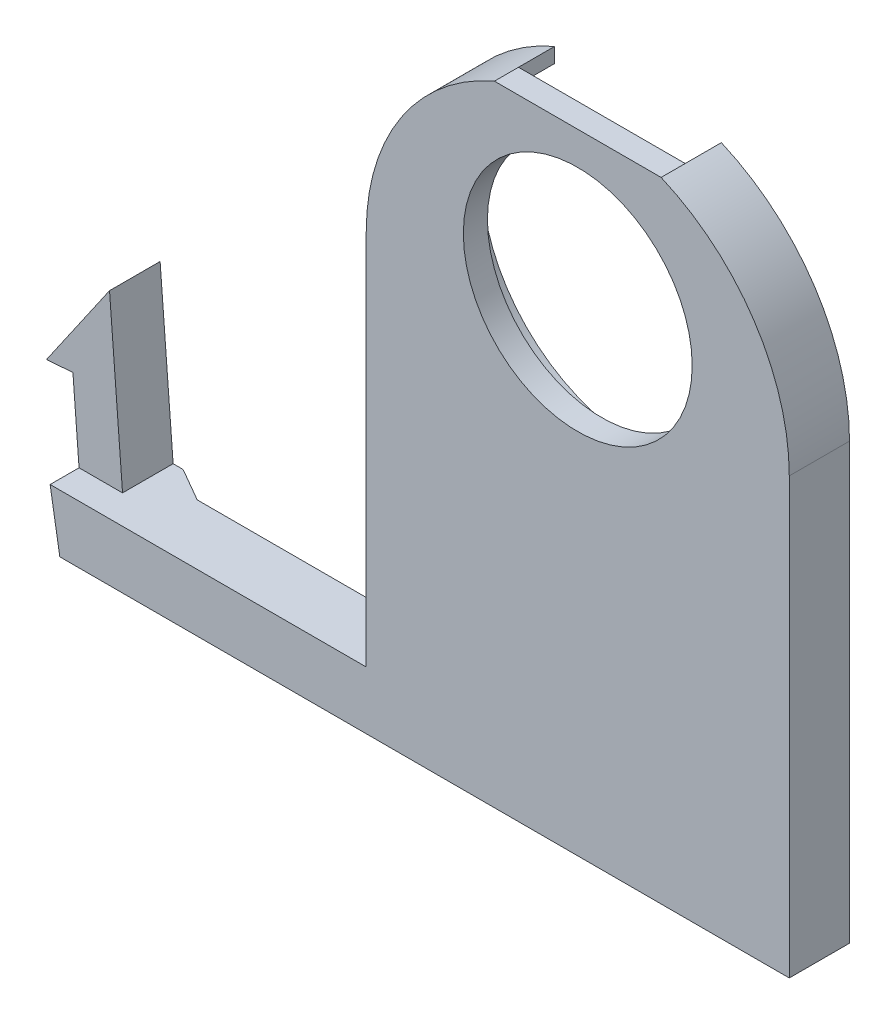
from build123d import *

# Parameters (mm, degrees)
BOSS_EXTRUDE1_DEPTH      = 1.5
BOSS_EXTRUDE2_DEPTH      = 1
SKETCH4_R                = 4.75
CUT_EXTRUDE1_DEPTH       = 23.898325822
SKETCH5_W                = 17.56
SKETCH5_H                = 2.5
BOSS_EXTRUDE3_DEPTH      = 0.15
SKETCH6_W                = 17.56
SKETCH6_H                = 2.5
BOSS_EXTRUDE4_DEPTH      = 11.35
SKETCH7_W                = 2.5
SKETCH7_H                = 2.4
BOSS_EXTRUDE5_DEPTH      = 12.72
BOSS_EXTRUDE6_DEPTH      = 0.8
BOSS_EXTRUDE6_DEPTH_BACK = 1.3
SKETCH9_W                = 1.40416608
SKETCH9_H                = 2.4
BOSS_EXTRUDE7_DEPTH      = 0.8
CHAMFER3_SIZE            = 1.039230485
CHAMFER3_SIZE_2          = 1.8
BOSS_EXTRUDE8_DEPTH      = 1.2


with BuildPart() as part:
    # Sketch1 → Boss-Extrude1 (new body)
    with BuildSketch(Plane.XY):
        with BuildLine():
            ThreePointArc((14.980604809, 6.55), (8.78, 2), (2.579395191, 6.55))
            Line((2.579395191, 6.55), (0, 6.55))
            Line((0, 6.55), (0, 0))
            Line((0, 0), (17.56, 0))
            Line((17.56, 0), (17.56, 6.55))
            Line((17.56, 6.55), (14.980604809, 6.55))
        make_face()
        with BuildLine():
            ThreePointArc((2.579395191, 6.55), (2.679421093, 10.743420825), (5.32, 14.002581212))
            Line((5.32, 14.002581212), (5.32, 14.619498126))
            ThreePointArc((5.32, 14.619498126), (1.449679407, 11.382680416), (0, 6.55))
            Line((0, 6.55), (2.579395191, 6.55))
        make_face()
        with BuildLine():
            ThreePointArc((12.24, 14.002581212), (14.880578907, 10.743420825), (14.980604809, 6.55))
            Line((14.980604809, 6.55), (17.56, 6.55))
            ThreePointArc((17.56, 6.55), (16.110320593, 11.382680416), (12.24, 14.619498126))
            Line((12.24, 14.619498126), (12.24, 14.002581212))
        make_face()
    extrude(amount=BOSS_EXTRUDE1_DEPTH)

    # Sketch3 → Boss-Extrude2 (add)
    with BuildSketch(Plane.XY.offset(1.5)):
        with BuildLine():
            Line((12.24, 14.619498126), (12.24, 14.002581212))
            ThreePointArc((12.24, 14.002581212), (8.78, 2), (5.32, 14.002581212))
            Line((5.32, 14.002581212), (5.32, 14.619498126))
            ThreePointArc((5.32, 14.619498126), (1.449679407, 11.382680416), (0, 6.55))
            Line((0, 6.55), (0, 0))
            Line((0, 0), (17.56, 0))
            Line((17.56, 0), (17.56, 6.55))
            ThreePointArc((17.56, 6.55), (16.110320593, 11.382680416), (12.24, 14.619498126))
        make_face()
        with BuildLine():
            Line((5.32, 14.619498126), (12.24, 14.619498126))
            Line((12.24, 14.619498126), (12.24, 14.002581212))
            ThreePointArc((12.24, 14.002581212), (8.78, 2), (5.32, 14.002581212))
            Line((5.32, 14.002581212), (5.32, 14.619498126))
        make_face()
    extrude(amount=BOSS_EXTRUDE2_DEPTH)

    # Sketch4 → Cut-Extrude1 (cut, through all)
    with BuildSketch(Plane(origin=(0, 0, 1.5), x_dir=(-1, 0, 0), z_dir=(0, 0, -1))):
        with Locations((-8.78, 8.5)):
            Circle(SKETCH4_R)
    extrude(amount=-CUT_EXTRUDE1_DEPTH, mode=Mode.SUBTRACT)

    # Sketch5 → Boss-Extrude3 (add)
    with BuildSketch(Plane.XZ):
        with Locations((8.78, 1.25)):
            Rectangle(SKETCH5_W, SKETCH5_H)
    extrude(amount=BOSS_EXTRUDE3_DEPTH)

    # Sketch6 → Boss-Extrude4 (add)
    with BuildSketch(Plane.XZ.offset(0.15)):
        with Locations((8.78, 1.25)):
            Rectangle(SKETCH6_W, SKETCH6_H)
    extrude(amount=BOSS_EXTRUDE4_DEPTH)

    # Sketch7 → Boss-Extrude5 (add)
    with BuildSketch(Plane.ZY):
        with Locations((1.25, -10.3)):
            Rectangle(SKETCH7_W, SKETCH7_H)
    extrude(amount=BOSS_EXTRUDE5_DEPTH)

    # Sketch8 → Boss-Extrude6 (add, two sides: drawn at the far end of the back side and taken through both)
    with BuildSketch(Plane(origin=(0, 0, 0), x_dir=(-1, 0, 0), z_dir=(0, 0, -1)).offset(-BOSS_EXTRUDE6_DEPTH_BACK)):
        Polygon((13.121190309, -9.1), (13.375962235, -5.8), (14.472698599, -5.884672011), (11.85625922, -2.1), (11.31583392, -9.1), (12.72, -9.1), (12.72, -11.5), align=None)
    extrude(amount=BOSS_EXTRUDE6_DEPTH + BOSS_EXTRUDE6_DEPTH_BACK)

    # Sketch9 → Boss-Extrude7 (add)
    with BuildSketch(Plane(origin=(0, 0, 0), x_dir=(-1, 0, 0), z_dir=(0, 0, -1))):
        with Locations((12.01791696, -10.3)):
            Rectangle(SKETCH9_W, SKETCH9_H)
    extrude(amount=BOSS_EXTRUDE7_DEPTH)

    # Chamfer3
    # the kernel refuses this chamfer: 1.8, 1.039230485 mm, written as the material it adds along each edge
    with BuildSketch(Plane(origin=(-11.31583392, -11.5, 0), x_dir=(-0.05789386240267112, 0, -0.9983227437537925), z_dir=(0, 1, 0))) as chamfer3_piece_1_section:
        Polygon((CHAMFER3_SIZE * 0.998322743313, -CHAMFER3_SIZE * 0.0578938623771), (-CHAMFER3_SIZE_2 * 0.0578938624027, -CHAMFER3_SIZE_2 * 0.998322743754), (0, 0), align=None)
    chamfer3_piece_1 = extrude(amount=2.4, mode=Mode.PRIVATE)
    chamfer3_piece_1 = split(chamfer3_piece_1, bisect_by=Plane(origin=(-11.20125383, -10.584128582, -0.396089169), z_dir=(-0.9970330575262718, -0.07697455553502185, 0)), keep=Keep.TOP, mode=Mode.PRIVATE)
    chamfer3_piece_1 = split(chamfer3_piece_1, bisect_by=Plane(origin=(-11.276211274, -10.589915567, -0.8), z_dir=(0, 0, 1)), keep=Keep.TOP, mode=Mode.PRIVATE)
    add(chamfer3_piece_1)
    with BuildSketch(Plane(origin=(-11.31583392, -11.5, 0), x_dir=(-0.05789386240267112, 0, -0.9983227437537925), z_dir=(0, 1, 0))) as chamfer3_piece_2_section:
        Polygon((CHAMFER3_SIZE * 0.998322743313, -CHAMFER3_SIZE * 0.0578938623771), (-CHAMFER3_SIZE_2 * 0.0578938624027, -CHAMFER3_SIZE_2 * 0.998322743754), (0, 0), align=None)
    chamfer3_piece_2 = extrude(amount=2.4, mode=Mode.PRIVATE)
    chamfer3_piece_2 = split(chamfer3_piece_2, bisect_by=Plane(origin=(-11.222198101, -10.312842427, -0.281258227), z_dir=(0.9970330575262718, 0.07697455553502185, 0)), keep=Keep.TOP, mode=Mode.PRIVATE)
    chamfer3_piece_2 = split(chamfer3_piece_2, bisect_by=Plane(origin=(-10.603533265, -10.265079266, -0.8), z_dir=(0, 0, 1)), keep=Keep.TOP, mode=Mode.PRIVATE)
    add(chamfer3_piece_2)

    # Sketch10 → Boss-Extrude8 (add)
    with BuildSketch(Plane.XY.offset(1.3)):
        Polygon((-12.72, -11.5), (-12.72, -9.1), (-13.121190309, -9.1), align=None)
    extrude(amount=BOSS_EXTRUDE8_DEPTH)


solid = part.part
